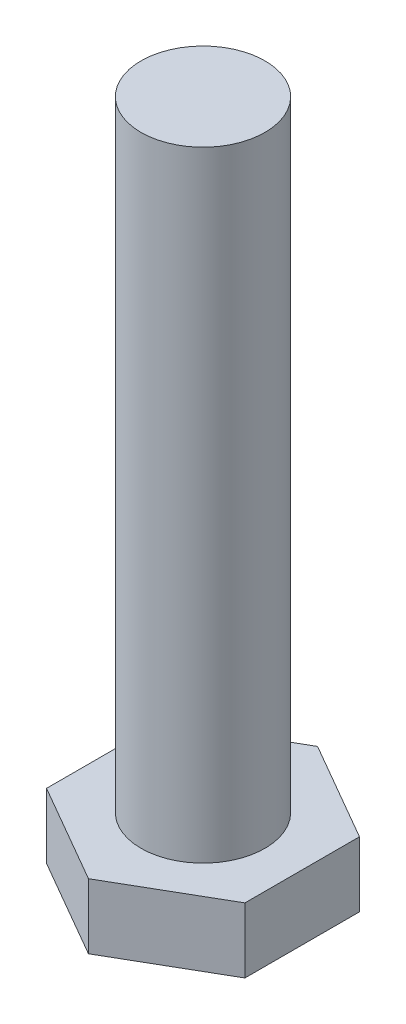
from build123d import *

# Parameters (mm, degrees)
EXTRUDE_1_DEPTH = 3.2
SKETCH_2_R      = 2.5
EXTRUDE_2_DEPTH = 25
CHAMFER_1_SIZE  = 1
CHAMFER_1_SIZE2 = 0.577350269


with BuildPart() as part:
    # Эскиз1 → Бобышка-Вытянуть1 (new body)
    with BuildSketch(Plane(origin=(0, 0, 0), x_dir=(1, 0, 0), z_dir=(0, 1, 0))):
        Polygon((4, -2.309401077), (4, 2.309401077), (0, 4.618802154), (-4, 2.309401077), (-4, -2.309401077), (0, -4.618802154), align=None)
    extrude(amount=EXTRUDE_1_DEPTH)

    # Эскиз2 → Бобышка-Вытянуть2 (add)
    with BuildSketch(Plane(origin=(0, 3.2, 0), x_dir=(1, 0, 0), z_dir=(0, 1, 0))):
        Circle(SKETCH_2_R)
    extrude(amount=EXTRUDE_2_DEPTH)

    # Фаска1
    chamfer_1_edges = [part.edges().sort_by_distance(p)[0] for p in [
        (2, 0, -3.464101615),
        (4, 0, 0),
        (2, 0, 3.464101615),
        (-2, 0, 3.464101615),
        (-4, 0, 0),
        (-2, 0, -3.464101615),
    ]]
    chamfer_1_side = [part.faces().sort_by_distance(p)[0] for p in [
        (0, 0, 0),
    ]]
    chamfer(chamfer_1_edges, length=CHAMFER_1_SIZE, length2=CHAMFER_1_SIZE2, reference=chamfer_1_side[0])


solid = part.part
